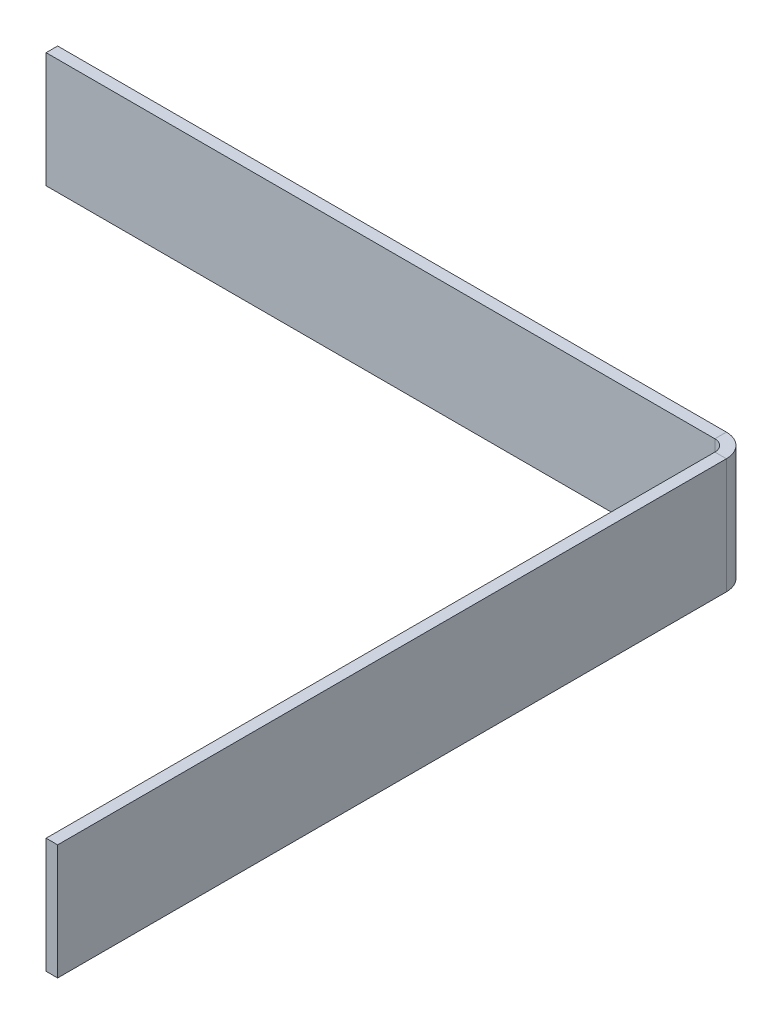
from build123d import *

# Parameters (mm, degrees)
SKETCH_1_W                       = 120
SKETCH_1_H                       = 20
EXTRUDE_2_DEPTH                  = 2
SM_EDGE_FLANGE_2_STRIP_W         = 12
SM_EDGE_FLANGE_2_STRIP_H         = 2
SM_EDGE_FLANGE_2_STRIP_CUT_DEPTH = 20
SM_EDGE_FLANGE_2_DEPTH           = 20


# Sheet-metal steps are written as plain solids
with BuildPart() as part:
    # Эскиз1 → Бобышка-Вытянуть2 (new body)
    with BuildSketch(Plane.XY):
        with Locations((60, 10)):
            Rectangle(SKETCH_1_W, SKETCH_1_H)
    extrude(amount=EXTRUDE_2_DEPTH)

    # Ребро-кромка2 strip (across the edge) → Ребро-кромка2 strip cut (cut)
    with BuildSketch(Plane(origin=(120, 0, 2), x_dir=(-1, 0, 0), z_dir=(0, 1, 0))):
        with Locations((-2, -1)):
            Rectangle(SM_EDGE_FLANGE_2_STRIP_W, SM_EDGE_FLANGE_2_STRIP_H)
    extrude(amount=SM_EDGE_FLANGE_2_STRIP_CUT_DEPTH, mode=Mode.SUBTRACT)

    # Ребро-кромка2 section (across the edge) → Ребро-кромка2 (add)
    with BuildSketch(Plane(origin=(120, 0, 2), x_dir=(-1, 0, 0), z_dir=(0, 1, 0))):
        with BuildLine():
            Line((0, 2), (0, 118))
            Line((0, 118), (2, 118))
            Line((2, 118), (2, 2))
            ThreePointArc((2, 2), (2.585786438, 0.585786438), (4, 0))
            Line((4, 0), (4, -2))
            ThreePointArc((4, -2), (1.171572875, -0.828427125), (0, 2))
        make_face()
    extrude(amount=SM_EDGE_FLANGE_2_DEPTH)


solid = part.part
